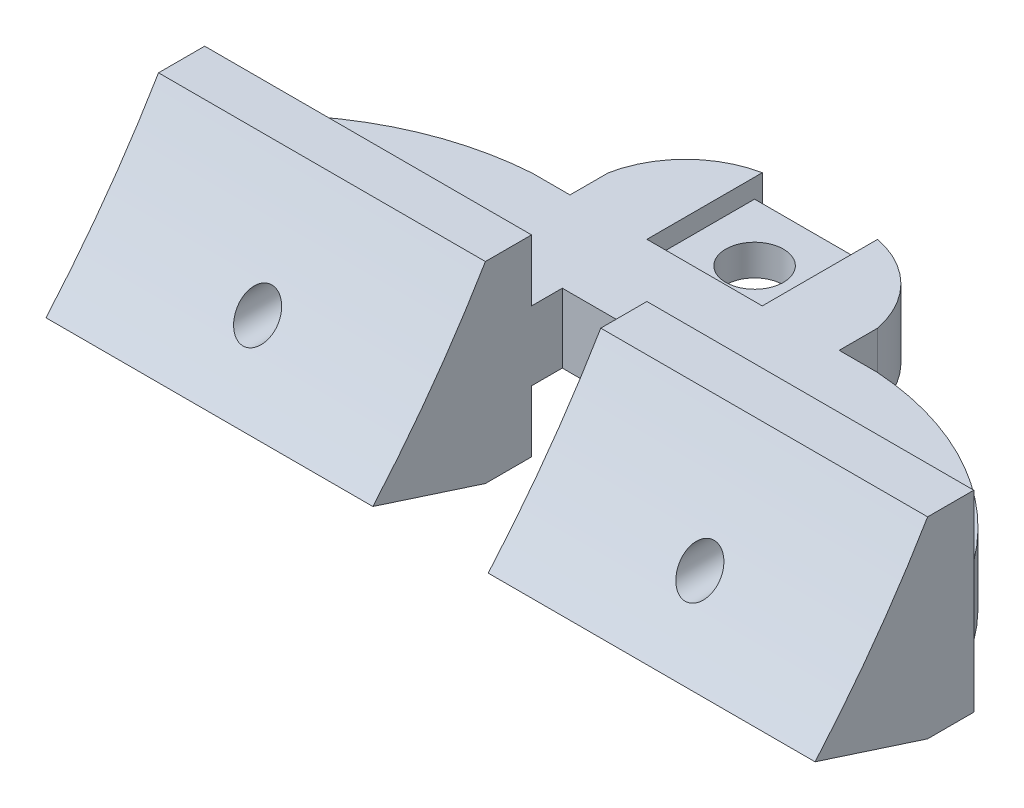
from build123d import *

# Parameters (mm, degrees)
ESQUISSE1_W                   = 6
ESQUISSE1_H                   = 1.61
BOSS_EXTRU_1_DEPTH            = 6
ESQUISSE2_R                   = 1.5
ENL_V_MAT_EXTRU_3_DEPTH       = 9.636671813
ESQUISSE5_W                   = 20
ESQUISSE5_H                   = 5
BOSS_EXTRU_2_DEPTH            = 8
ESQUISSE6_W                   = 40
ESQUISSE6_H                   = 10
BOSS_EXTRU_3_DEPTH            = 0.4
ESQUISSE7_W                   = 4
ESQUISSE7_H                   = 3.6
BOSS_EXTRU_4_DEPTH            = 6
ENL_V_MAT_EXTRU_4_DEPTH       = 6
ESQUISSE9_W                   = 6
ESQUISSE9_H                   = 10
ENL_V_MAT_EXTRU_5_DEPTH       = 4
ENL_V_MAT_EXTRU_6_DEPTH       = 3.2
ENL_V_MAT_EXTRU_7_DEPTH       = 3.2
BOSS_EXTRU_5_DEPTH            = 0.01
BOSS_EXTRU_5_DEPTH_BACK       = 3.61
ESQUISSE13_W                  = 4
ESQUISSE13_H                  = 0.02
ENL_V_MAT_EXTRU_8_DEPTH       = 26.16346558
ENL_V_MAT_EXTRU_9_DEPTH       = 26.283196001
BOSS_EXTRU_6_DEPTH            = 17
R_P_TITION_LIN_AIRE1_COUNT    = 2
R_P_TITION_LIN_AIRE1_PITCH    = 23
ENL_V_MAT_EXTRU_10_DEPTH      = 27.582701142
ENL_V_MAT_EXTRU_10_DEPTH_BACK = 27.582701142
ESQUISSE17_R                  = 1


with BuildPart() as part:
    # Esquisse1 → Boss.-Extru.1 (new body)
    with BuildSketch(Plane.XY):
        with Locations((3, 0.805)):
            Rectangle(ESQUISSE1_W, ESQUISSE1_H)
    extrude(amount=-BOSS_EXTRU_1_DEPTH)

    # Esquisse2 → Enlèv. mat.-Extru.3 (cut, through all)
    with BuildSketch(Plane(origin=(0, 0, 0), x_dir=(1, 0, 0), z_dir=(0, 1, 0))):
        with Locations((3, 3)):
            Circle(ESQUISSE2_R)
    extrude(amount=ENL_V_MAT_EXTRU_3_DEPTH, mode=Mode.SUBTRACT)



with BuildPart() as body_2:
    # Esquisse5 → Boss.-Extru.2 (new body)
    with BuildSketch(Plane.XY):
        with Locations((-7, -1.7)):
            Rectangle(ESQUISSE5_W, ESQUISSE5_H)
        with Locations((-7, 3.3)):
            Rectangle(ESQUISSE5_W, ESQUISSE5_H)
        with Locations((13, -1.7)):
            Rectangle(ESQUISSE5_W, ESQUISSE5_H)
        with Locations((13, 3.3)):
            Rectangle(ESQUISSE5_W, ESQUISSE5_H)
    extrude(amount=BOSS_EXTRU_2_DEPTH)


with BuildPart() as part_1:
    add(part.part)

    add(body_2.part)  # Boss.-Extru.3 merges body 2
    # Esquisse6 → Boss.-Extru.3 (add)
    with BuildSketch(Plane(origin=(0, 0, 0), x_dir=(-1, 0, 0), z_dir=(0, 0, -1))):
        with Locations((-3, 0.8)):
            Rectangle(ESQUISSE6_W, ESQUISSE6_H)
    extrude(amount=BOSS_EXTRU_3_DEPTH)

    # Esquisse7 → Boss.-Extru.4 (add)
    with BuildSketch(Plane(origin=(0, 0, -0.4), x_dir=(-1, 0, 0), z_dir=(0, 0, -1))):
        with Locations((2, 0.81)):
            Rectangle(ESQUISSE7_W, ESQUISSE7_H)
        with Locations((-8, 0.8)):
            Rectangle(ESQUISSE7_W, ESQUISSE7_H)
    extrude(amount=BOSS_EXTRU_4_DEPTH)

    # Esquisse8 → Enlèv. mat.-Extru.4 (cut)
    with BuildSketch(Plane.XZ.offset(1)):
        with BuildLine():
            Line((10, -6.4), (10, -2.4))
            ThreePointArc((10, -2.4), (8.605551275, -5.005551275), (6, -6.4))
            Line((6, -6.4), (10, -6.4))
        make_face()
        with BuildLine():
            Line((-4, -6.4), (0, -6.4))
            ThreePointArc((0, -6.4), (-2.605551275, -5.005551275), (-4, -2.4))
            Line((-4, -2.4), (-4, -6.4))
        make_face()
    extrude(amount=-ENL_V_MAT_EXTRU_4_DEPTH, mode=Mode.SUBTRACT)

    # Esquisse9 → Enlèv. mat.-Extru.5 (cut)
    with BuildSketch(Plane.XY.offset(8)):
        with Locations((3, 0.8)):
            Rectangle(ESQUISSE9_W, ESQUISSE9_H)
    extrude(amount=-ENL_V_MAT_EXTRU_5_DEPTH, mode=Mode.SUBTRACT)

    # Esquisse10 → Enlèv. mat.-Extru.6 (cut)
    with BuildSketch(Plane.XZ.offset(4.2)):
        Polygon((0, 5.6), (-17, 5.6), (-17, -0.4), (23, -0.4), (23, 5.6), (6, 5.6), (6, 4), (0, 4), align=None)
    extrude(amount=-ENL_V_MAT_EXTRU_6_DEPTH, mode=Mode.SUBTRACT)

    # Esquisse11 → Enlèv. mat.-Extru.7 (cut)
    with BuildSketch(Plane(origin=(0, 5.8, 0), x_dir=(1, 0, 0), z_dir=(0, 1, 0))):
        Polygon((-17, 0.4), (-17, -5.6), (0, -5.6), (0, -4), (6, -4), (6, -5.6), (23, -5.6), (23, 0.4), align=None)
    extrude(amount=-ENL_V_MAT_EXTRU_7_DEPTH, mode=Mode.SUBTRACT)

    # Esquisse12 → Boss.-Extru.5 (add, two sides: drawn at the far end of the back side and taken through both)
    with BuildSketch(Plane.XZ.offset(0.99).offset(-BOSS_EXTRU_5_DEPTH_BACK)):
        with BuildLine():
            ThreePointArc((-4, -2.4), (-2.605551275, -5.005551275), (0, -6.4))
            Line((0, -6.4), (0, -0.4))
            Line((0, -0.4), (-4, -0.4))
            Line((-4, -0.4), (-4, -2.4))
        make_face()
    extrude(amount=BOSS_EXTRU_5_DEPTH + BOSS_EXTRU_5_DEPTH_BACK)

    # Esquisse13 → Enlèv. mat.-Extru.8 (cut, through all)
    with BuildSketch(Plane.XY.offset(-0.4)):
        with Locations((-2, 2.61)):
            Rectangle(ESQUISSE13_W, ESQUISSE13_H)
    extrude(amount=-ENL_V_MAT_EXTRU_8_DEPTH, mode=Mode.SUBTRACT)

    # Esquisse14 → Enlèv. mat.-Extru.9 (cut, through all)
    with BuildSketch(Plane.XZ.offset(1)):
        with BuildLine():
            ThreePointArc((-5.952431015, -0.4), (-12.135126039, 1.386773408), (-17, 5.6))
            Line((-17, 5.6), (-17, -0.4))
            Line((-17, -0.4), (-5.952431015, -0.4))
        make_face()
        with BuildLine():
            ThreePointArc((23, 5.6), (18.135126039, 1.386773408), (11.952431015, -0.4))
            Line((11.952431015, -0.4), (23, -0.4))
            Line((23, -0.4), (23, 5.6))
        make_face()
    extrude(amount=-ENL_V_MAT_EXTRU_9_DEPTH, mode=Mode.SUBTRACT)

    # Esquisse15 → Boss.-Extru.6 (add)
    with BuildSketch(Plane(origin=(23, 0, 0), x_dir=(0, 0, -1), z_dir=(1, 0, 0))):
        with BuildLine():
            Line((-13.852294772, -2.308677198), (-8, -4.2))
            Line((-8, -4.2), (-8, 5.8))
            ThreePointArc((-8, 5.8), (-10.741476926, 1.612378753), (-13.852294772, -2.308677198))
        make_face()
    boss_extru_6 = extrude(amount=-BOSS_EXTRU_6_DEPTH)

    # Répétition linéaire1: Boss.-Extru.6 ×2
    with Locations(*[(-i * R_P_TITION_LIN_AIRE1_PITCH, 0, 0) for i in range(1, R_P_TITION_LIN_AIRE1_COUNT)]):
        add(boss_extru_6)

    # Esquisse17 → Enlèv. mat.-Extru.10 (cut, two sides: drawn at the far end of the back side and taken through both)
    with BuildSketch(Plane(origin=(0, 0, 5.6), x_dir=(-1, 0, 0), z_dir=(0, 0, -1)).offset(-ENL_V_MAT_EXTRU_10_DEPTH_BACK)):
        with Locations((8.5, 0.8)):
            Circle(ESQUISSE17_R)
        with Locations((-14.5, 0.8)):
            Circle(ESQUISSE17_R)
    extrude(amount=ENL_V_MAT_EXTRU_10_DEPTH + ENL_V_MAT_EXTRU_10_DEPTH_BACK, mode=Mode.SUBTRACT)


solid = part_1.part
